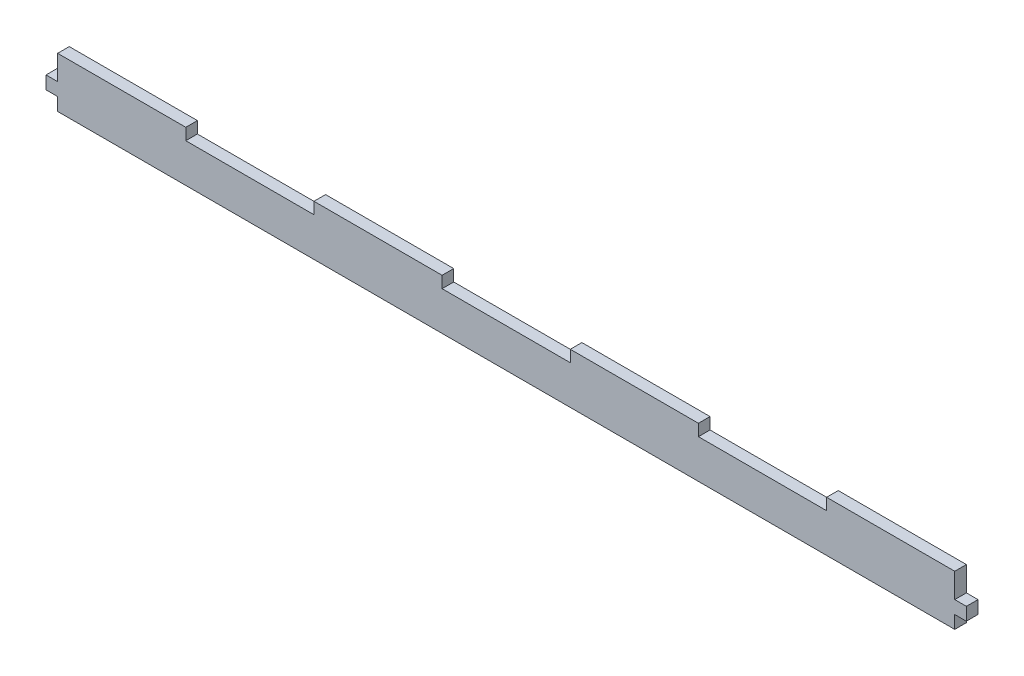
from build123d import *

# Parameters (mm, degrees)
SKETCH1_W               = 415
SKETCH1_H               = 126.5
BOSS_EXTRUDE1_DEPTH     = 6
SKETCH2_W               = 463
SKETCH2_H               = 6
BOSS_EXTRUDE2_DEPTH     = 20
CUT_EXTRUDE1_DEPTH      = 250.967622903
CUT_EXTRUDE1_DEPTH_BACK = 250.967622903
SKETCH1_2_W             = 415
SKETCH1_2_H             = 126.5
SKETCH2_4_W             = 66.142857143
SKETCH2_4_H             = 6
BOSS_EXTRUDE3_DEPTH     = 6
SKETCH4_W               = 6
SKETCH4_H               = 6.666666666
BOSS_EXTRUDE4_DEPTH     = 6


with BuildPart() as part:
    # Sketch1 → Boss-Extrude1 (new body)
    with BuildSketch(Plane(origin=(0, 0, 0), x_dir=(1, 0, 0), z_dir=(0, 1, 0))):
        Rectangle(SKETCH1_W, SKETCH1_H)
    extrude(amount=BOSS_EXTRUDE1_DEPTH)

    # Sketch1<2> → Cut-Extrude1 (cut, two sides: drawn at the far end of the back side and taken through both)
    with BuildSketch(Plane(origin=(0, 0, 0), x_dir=(1, 0, 0), z_dir=(0, 1, 0)).offset(-CUT_EXTRUDE1_DEPTH_BACK)):
        Rectangle(SKETCH1_2_W, SKETCH1_2_H)
    extrude(amount=CUT_EXTRUDE1_DEPTH + CUT_EXTRUDE1_DEPTH_BACK, mode=Mode.SUBTRACT)


with BuildPart() as body_2:
    # Sketch2 → Boss-Extrude2 (new body)
    with BuildSketch(Plane(origin=(0, 6, 0), x_dir=(1, 0, 0), z_dir=(0, 1, 0))):
        with Locations((0, 90.25)):
            Rectangle(SKETCH2_W, SKETCH2_H)
    extrude(amount=-BOSS_EXTRUDE2_DEPTH)

    # Sketch2<4> → Boss-Extrude3 (add)
    with BuildSketch(Plane(origin=(0, 6, 0), x_dir=(1, 0, 0), z_dir=(0, 1, 0))):
        with Locations((198.428571429, 90.25)):
            Rectangle(SKETCH2_4_W, SKETCH2_4_H)
        with Locations((66.142857143, 90.25)):
            Rectangle(SKETCH2_4_W, SKETCH2_4_H)
        with Locations((-66.142857143, 90.25)):
            Rectangle(SKETCH2_4_W, SKETCH2_4_H)
        with Locations((-198.428571429, 90.25)):
            Rectangle(SKETCH2_4_W, SKETCH2_4_H)
    extrude(amount=BOSS_EXTRUDE3_DEPTH)

    # Sketch4 → Boss-Extrude4 (add)
    with BuildSketch(Plane.ZY.offset(231.5)):
        with Locations((-90.25, -4)):
            Rectangle(SKETCH4_W, SKETCH4_H)
    boss_extrude4 = extrude(amount=BOSS_EXTRUDE4_DEPTH)

    # Mirror2: Boss-Extrude4 across plane
    add(boss_extrude4.mirror(Plane(origin=(0, 0, 0), x_dir=(0, 0, 1), z_dir=(1, 0, 0))))


solid = body_2.part
